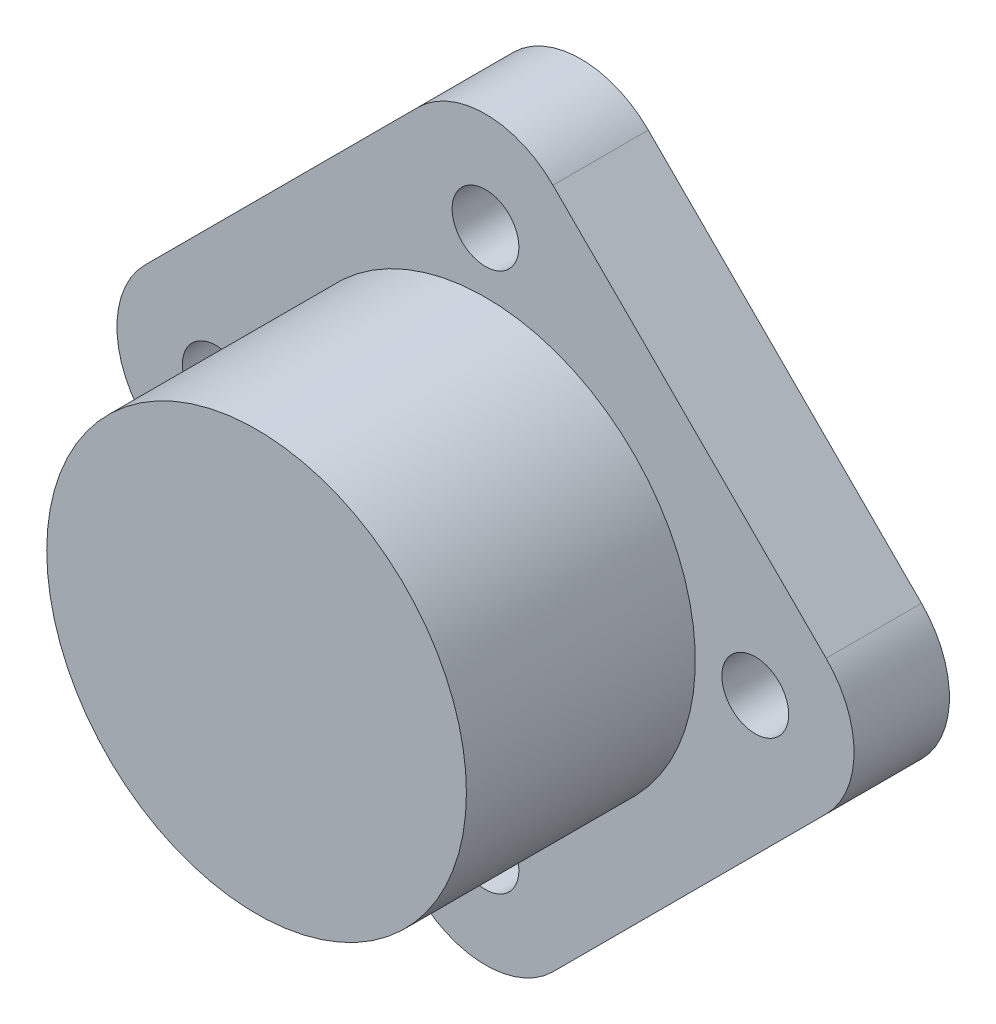
from build123d import *

# Parameters (mm, degrees)
SKETCH1_R           = 4.445
BOSS_EXTRUDE1_DEPTH = 12.7
FILLET1_R           = 12.7
SKETCH2_R           = 27.94
BOSS_EXTRUDE2_DEPTH = 43.18


with BuildPart() as part:
    # Sketch1 → Boss-Extrude1 (new body)
    with BuildSketch(Plane.XY):
        Polygon((10.696130127, -43.269340837), (-25.224894357, -7.348316353), (-34.430434771, 1.857224061), (-25.224894357, 11.062764475), (10.696130127, 46.98378896), (19.901670541, 56.189329374), (29.107210955, 46.98378896), (65.02823544, 11.062764475), (74.233775854, 1.857224061), (65.02823544, -7.348316353), (29.107210955, -43.269340837), (19.901670541, -52.474881251), align=None)
        with Locations((-16.019353943, 1.857224061)):
            Circle(SKETCH1_R, mode=Mode.SUBTRACT)
        with Locations((19.901670541, 37.778248545)):
            Circle(SKETCH1_R, mode=Mode.SUBTRACT)
        with Locations((19.901670541, -34.063800423)):
            Circle(SKETCH1_R, mode=Mode.SUBTRACT)
        with Locations((55.822695025, 1.857224061)):
            Circle(SKETCH1_R, mode=Mode.SUBTRACT)
    extrude(amount=BOSS_EXTRUDE1_DEPTH)

    # Fillet1
    fillet1_edges = [part.edges().sort_by_distance(p)[0] for p in [
        (19.901670541, -52.474881251, 6.35),
        (74.233775854, 1.857224061, 6.35),
        (-34.430434771, 1.857224061, 6.35),
        (19.901670541, 56.189329374, 6.35),
    ]]
    fillet(fillet1_edges, radius=FILLET1_R)

    # Sketch2 → Boss-Extrude2 (add)
    with BuildSketch(Plane.XY):
        with Locations((19.901670541, 1.857224061)):
            Circle(SKETCH2_R)
    extrude(amount=BOSS_EXTRUDE2_DEPTH)


solid = part.part
